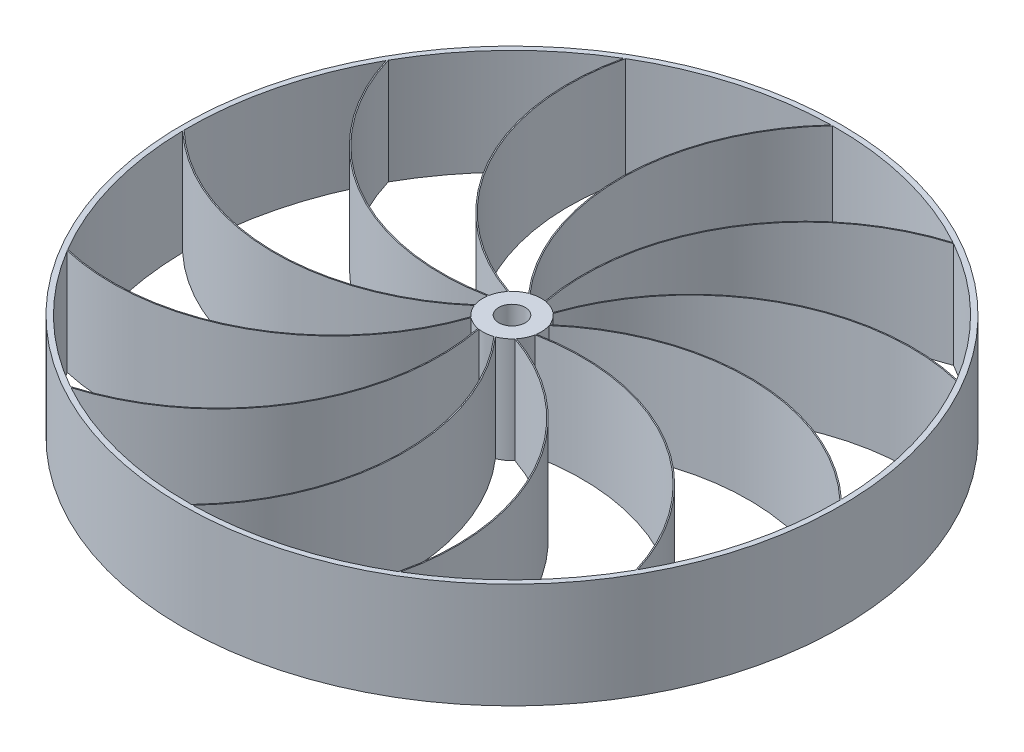
from build123d import *

# Parameters (mm, degrees)
SKETCH1_R           = 62.5
SKETCH1_R_2         = 2.525
BOSS_EXTRUDE1_DEPTH = 20


with BuildPart() as part:
    # Sketch1 → Boss-Extrude1 (new body)
    with BuildSketch(Plane(origin=(0, 0, 0), x_dir=(1, 0, 0), z_dir=(0, 1, 0))):
        Circle(SKETCH1_R)
        Circle(SKETCH1_R_2, mode=Mode.SUBTRACT)
        with BuildLine():
            ThreePointArc((2.003757487, -5.148842679), (12.315837889, -33.518298596), (0.974690131, -61.492275768))
            ThreePointArc((0.974690131, -61.492275768), (16.723112923, -59.182662108), (31.351368418, -52.908805489))
            ThreePointArc((31.351368418, -52.908805489), (27.278141457, -23.017593109), (4.172560221, -3.621514352))
            ThreePointArc((4.172560221, -3.621514352), (3.181180294, -4.517268748), (2.003757487, -5.148842679))
        make_face(mode=Mode.SUBTRACT)
        with BuildLine():
            ThreePointArc((1.802785974, -5.22260354), (12.114766915, -33.572891095), (0.696678749, -61.496053847))
            ThreePointArc((0.696678749, -61.496053847), (-15.108690432, -59.615245311), (-29.90203147, -53.741218017))
            ThreePointArc((-29.90203147, -53.741218017), (-6.093320818, -35.18561702), (-0.839116453, -5.460907304))
            ThreePointArc((-0.839116453, -5.460907304), (0.496348575, -5.502659638), (1.802785974, -5.22260354))
        make_face(mode=Mode.SUBTRACT)
        with BuildLine():
            ThreePointArc((-1.050043319, -5.424300326), (-6.294749638, -35.132360024), (-30.144685428, -53.605484238))
            ThreePointArc((-30.144685428, -53.605484238), (-42.892132387, -44.073971676), (-52.766527886, -31.590244299))
            ThreePointArc((-52.766527886, -31.590244299), (-22.869779132, -27.424977779), (-3.457149817, -4.309726226))
            ThreePointArc((-3.457149817, -4.309726226), (-2.321479344, -5.013617322), (-1.050043319, -5.424300326))
        make_face(mode=Mode.SUBTRACT)
        with BuildLine():
            ThreePointArc((-3.621514352, -4.172560221), (-23.017593109, -27.278141457), (-52.908805489, -31.351368418))
            ThreePointArc((-52.908805489, -31.351368418), (-59.182662108, -16.723112923), (-61.492275768, -0.974690131))
            ThreePointArc((-61.492275768, -0.974690131), (-33.518298596, -12.315837889), (-5.148842679, -2.003757487))
            ThreePointArc((-5.148842679, -2.003757487), (-4.517268748, -3.181180294), (-3.621514352, -4.172560221))
        make_face(mode=Mode.SUBTRACT)
        with BuildLine():
            ThreePointArc((-5.22260354, -1.802785974), (-33.572891095, -12.114766915), (-61.496053847, -0.696678749))
            ThreePointArc((-61.496053847, -0.696678749), (-59.615245311, 15.108690432), (-53.741218017, 29.90203147))
            ThreePointArc((-53.741218017, 29.90203147), (-35.18561702, 6.093320818), (-5.460907304, 0.839116453))
            ThreePointArc((-5.460907304, 0.839116453), (-5.502659638, -0.496348575), (-5.22260354, -1.802785974))
        make_face(mode=Mode.SUBTRACT)
        with BuildLine():
            ThreePointArc((-5.424300326, 1.050043319), (-35.132360024, 6.294749638), (-53.605484238, 30.144685428))
            ThreePointArc((-53.605484238, 30.144685428), (-44.073971676, 42.892132387), (-31.590244299, 52.766527886))
            ThreePointArc((-31.590244299, 52.766527886), (-27.424977779, 22.869779132), (-4.309726226, 3.457149817))
            ThreePointArc((-4.309726226, 3.457149817), (-5.013617322, 2.321479344), (-5.424300326, 1.050043319))
        make_face(mode=Mode.SUBTRACT)
        with BuildLine():
            ThreePointArc((-4.172560221, 3.621514352), (-27.278141457, 23.017593109), (-31.351368418, 52.908805489))
            ThreePointArc((-31.351368418, 52.908805489), (-16.723112923, 59.182662108), (-0.974690131, 61.492275768))
            ThreePointArc((-0.974690131, 61.492275768), (-12.315837889, 33.518298596), (-2.003757487, 5.148842679))
            ThreePointArc((-2.003757487, 5.148842679), (-3.181180294, 4.517268748), (-4.172560221, 3.621514352))
        make_face(mode=Mode.SUBTRACT)
        with BuildLine():
            ThreePointArc((-1.802785974, 5.22260354), (-12.114766915, 33.572891095), (-0.696678749, 61.496053847))
            ThreePointArc((-0.696678749, 61.496053847), (15.108690432, 59.615245311), (29.90203147, 53.741218017))
            ThreePointArc((29.90203147, 53.741218017), (6.093320818, 35.18561702), (0.839116453, 5.460907304))
            ThreePointArc((0.839116453, 5.460907304), (-0.496348575, 5.502659638), (-1.802785974, 5.22260354))
        make_face(mode=Mode.SUBTRACT)
        with BuildLine():
            ThreePointArc((1.050043319, 5.424300326), (6.294749638, 35.132360024), (30.144685428, 53.605484238))
            ThreePointArc((30.144685428, 53.605484238), (42.892132387, 44.073971676), (52.766527886, 31.590244299))
            ThreePointArc((52.766527886, 31.590244299), (22.869779132, 27.424977779), (3.457149817, 4.309726226))
            ThreePointArc((3.457149817, 4.309726226), (2.321479344, 5.013617322), (1.050043319, 5.424300326))
        make_face(mode=Mode.SUBTRACT)
        with BuildLine():
            ThreePointArc((3.621514352, 4.172560221), (23.017593109, 27.278141457), (52.908805489, 31.351368418))
            ThreePointArc((52.908805489, 31.351368418), (59.182662108, 16.723112923), (61.492275768, 0.974690131))
            ThreePointArc((61.492275768, 0.974690131), (33.518298596, 12.315837889), (5.148842679, 2.003757487))
            ThreePointArc((5.148842679, 2.003757487), (4.517268748, 3.181180294), (3.621514352, 4.172560221))
        make_face(mode=Mode.SUBTRACT)
        with BuildLine():
            ThreePointArc((5.22260354, 1.802785974), (33.572891095, 12.114766915), (61.496053847, 0.696678749))
            ThreePointArc((61.496053847, 0.696678749), (59.615245311, -15.108690432), (53.741218017, -29.90203147))
            ThreePointArc((53.741218017, -29.90203147), (35.18561702, -6.093320818), (5.460907304, -0.839116453))
            ThreePointArc((5.460907304, -0.839116453), (5.502659638, 0.496348575), (5.22260354, 1.802785974))
        make_face(mode=Mode.SUBTRACT)
        with BuildLine():
            ThreePointArc((5.424300326, -1.050043319), (35.132360024, -6.294749638), (53.605484238, -30.144685428))
            ThreePointArc((53.605484238, -30.144685428), (44.073971676, -42.892132387), (31.590244299, -52.766527886))
            ThreePointArc((31.590244299, -52.766527886), (27.424977779, -22.869779132), (4.309726226, -3.457149817))
            ThreePointArc((4.309726226, -3.457149817), (5.013617322, -2.321479344), (5.424300326, -1.050043319))
        make_face(mode=Mode.SUBTRACT)
    extrude(amount=BOSS_EXTRUDE1_DEPTH)


solid = part.part
